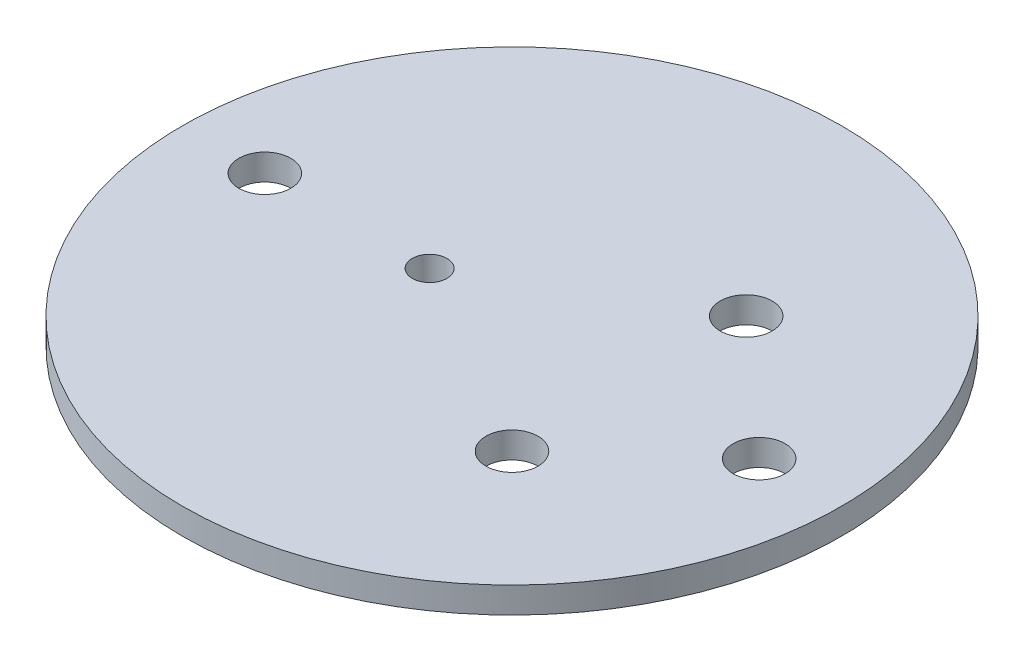
from build123d import *

# Parameters (mm, degrees)
SKETCH1_R           = 38
SKETCH1_R_2         = 3
SKETCH1_R_3         = 2
BOSS_EXTRUDE1_DEPTH = 3


with BuildPart() as part:
    # Sketch1 → Boss-Extrude1 (new body)
    with BuildSketch(Plane(origin=(0, 0, 0), x_dir=(1, 0, 0), z_dir=(0, 1, 0))):
        Circle(SKETCH1_R)
        with Locations((13.5, -13.5)):
            Circle(SKETCH1_R_2, mode=Mode.SUBTRACT)
        with Locations((-28.5, 0)):
            Circle(SKETCH1_R_2, mode=Mode.SUBTRACT)
        with Locations((-9.5, 0)):
            Circle(SKETCH1_R_3, mode=Mode.SUBTRACT)
        with Locations((13.5, 13.5)):
            Circle(SKETCH1_R_2, mode=Mode.SUBTRACT)
        with Locations((28.5, 0)):
            Circle(SKETCH1_R_2, mode=Mode.SUBTRACT)
    extrude(amount=-BOSS_EXTRUDE1_DEPTH)


solid = part.part
